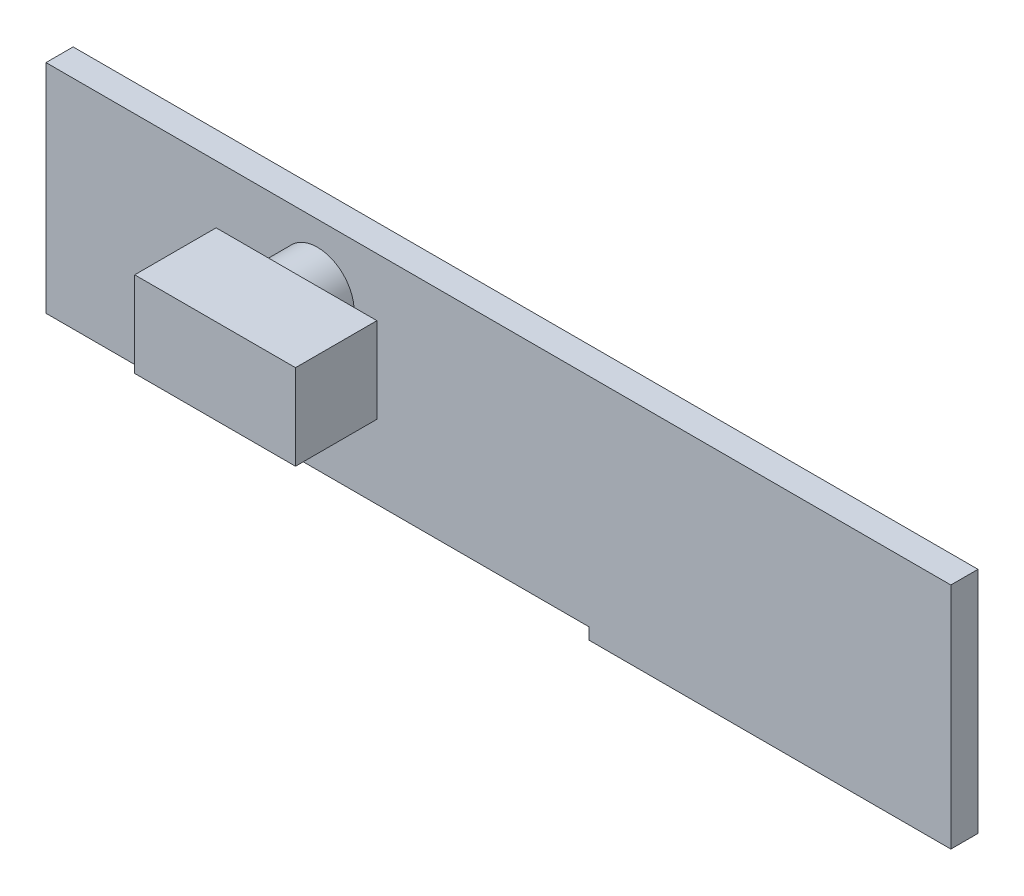
from build123d import *

# Parameters (mm, degrees)
SKETCH2_W           = 254
SKETCH2_H           = 12.7
BOSS_EXTRUDE1_DEPTH = 101.6
SKETCH3_R           = 17.140791438
BOSS_EXTRUDE2_DEPTH = 19.05
SKETCH4_W           = 75.235944222
SKETCH4_H           = 39.955088207
BOSS_EXTRUDE3_DEPTH = 38.1
SCALE2_SCALE        = 0.06
ROTATE_ANGLE        = 90
SCALE5_SCALE        = 0.25
SCALE6_SCALE        = 0.25
SKETCH6_W           = 0.635
SKETCH6_H           = 0.047625
BOSS_EXTRUDE6_DEPTH = 0.40132


with BuildPart() as part:
    # Sketch2 → Boss-Extrude1 (new body)
    with BuildSketch(Plane.XY):
        with Locations((79.130769231, 14.898076923)):
            Rectangle(SKETCH2_W, SKETCH2_H)
    extrude(amount=BOSS_EXTRUDE1_DEPTH)

    # Sketch3 → Boss-Extrude2 (add)
    with BuildSketch(Plane(origin=(0, 21.248076923, 0), x_dir=(1, 0, 0), z_dir=(0, 1, 0))):
        with Locations((79.130769231, -28.483063876)):
            Circle(SKETCH3_R)
    extrude(amount=BOSS_EXTRUDE2_DEPTH)

    # Sketch4 → Boss-Extrude3 (add)
    with BuildSketch(Plane(origin=(0, 40.298076923, 0), x_dir=(1, 0, 0), z_dir=(0, 1, 0))):
        with Locations((88.38546847, -28.088530296)):
            Rectangle(SKETCH4_W, SKETCH4_H)
    extrude(amount=BOSS_EXTRUDE3_DEPTH)


with BuildPart() as part_1:
    # Scale2: scaled about (81.435728249, 26.575729378, 44.290186425)
    add(part.part.scale(SCALE2_SCALE).moved(Location((76.549584554, 24.981185615, 41.632775239))))


with BuildPart() as part_2:
    # rotate: moved
    add(part_1.part.rotate(Axis((0, 33.666927966, 26.550068274), (1, 0, 0)), ROTATE_ANGLE))


with BuildPart() as part_3:
    # Scale5: scaled about (81.435728249, 15.926809815, 19.458869686)
    add(part_2.part.scale(SCALE5_SCALE).moved(Location((61.076796187, 11.945107361, 14.594152264))))


with BuildPart() as part_4:
    # Move Body 4 x: moved
    add(part_3.part.moved(Location((-101.6, 0, 0))))


with BuildPart() as part_5:
    # Move Body 2 y: moved
    add(part_4.part.moved(Location((0, -55.88, 0))))


with BuildPart() as part_6:
    # Scale6: scaled about (-20.164271751, -39.953190185, 19.458869686)
    add(part_5.part.scale(SCALE6_SCALE).moved(Location((-15.123203813, -29.964892639, 14.594152264))))


with BuildPart() as part_7:
    # Move Body 2.1z: moved
    add(part_6.part.moved(Location((0, 0, -30.48))))

    # Sketch6 → Boss-Extrude6 (add)
    with BuildSketch(Plane(origin=(0, -39.787101985, 0), x_dir=(1, 0, 0), z_dir=(0, 1, 0))):
        with Locations((-19.379165348, 11.064921511)):
            Rectangle(SKETCH6_W, SKETCH6_H)
    extrude(amount=-BOSS_EXTRUDE6_DEPTH)


solid = part_7.part
